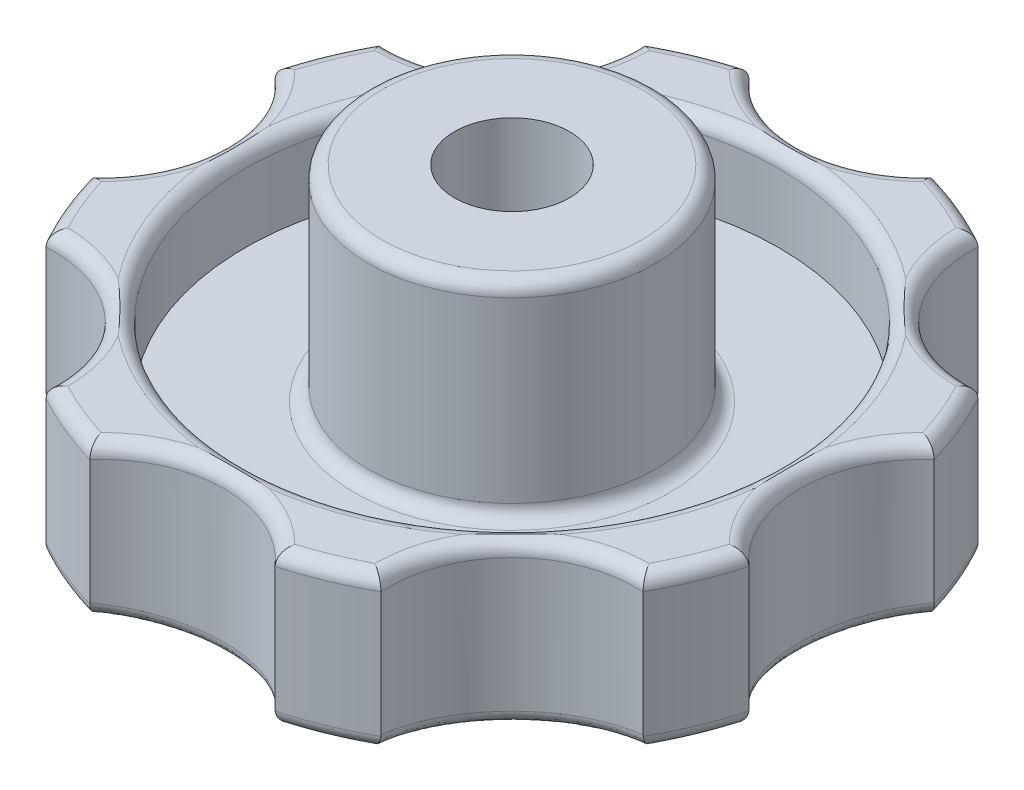
from build123d import *

# Parameters (mm, degrees)
SKETCH2_R          = 4.2
CUT_EXTRUDE1_DEPTH = 42.641325747
SKETCH3_R          = 9
CUT_EXTRUDE2_DEPTH = 38.650100644
FILLET1_R          = 1
FILLET2_R          = 1


with BuildPart() as part:
    # Sketch1 → Revolve4 (revolve)
    with BuildSketch(Plane.XY, mode=Mode.PRIVATE) as revolve4_sk:
        with BuildLine():
            Line((0, 0), (0, 22))
            Line((0, 22), (-10.5, 22))
            Line((-10.5, 22), (-10.5, 7))
            Line((-10.5, 7), (-19.5, 7))
            Line((-19.5, 7), (-19.5, 13))
            Line((-19.5, 13), (-25, 13))
            Line((-25, 13), (-25, 2))
            add(Edge.make_bspline(
                [(-0.007465499, 1.993e-06), (-12.589679051, 0.003656939), (-25, 2)],
                knots=[0.00029658, 0.00029658, 0.00029658, 1, 1, 1], degree=2))
            Line((-0.007465499, 1.993e-06), (0, 0))
        make_face()
    revolve(revolve4_sk.sketch.rotate(Axis((0, 66.230366492, 0), (0, -1, 0)), 270), axis=Axis((0, 66.230366492, 0), (0, -1, 0)))

    # Sketch2 → Cut-Extrude1 (cut, through all)
    with BuildSketch(Plane(origin=(0, 22, 0), x_dir=(1, 0, 0), z_dir=(0, 1, 0))):
        with Locations(Location((0, 0, 0), (0, 0, 270))):
            Circle(SKETCH2_R)
    extrude(amount=-CUT_EXTRUDE1_DEPTH, mode=Mode.SUBTRACT)

    # Sketch3 → Cut-Extrude2 (cut, through all)
    with BuildSketch(Plane(origin=(0, 13, 0), x_dir=(1, 0, 0), z_dir=(0, 1, 0))):
        with Locations((0, 30)):
            Circle(SKETCH3_R)
        with Locations((21.213203436, 21.213203436)):
            Circle(SKETCH3_R)
        with Locations((30, 0)):
            Circle(SKETCH3_R)
        with Locations((21.213203436, -21.213203436)):
            Circle(SKETCH3_R)
        with Locations((0, -30)):
            Circle(SKETCH3_R)
        with Locations((-21.213203436, -21.213203436)):
            Circle(SKETCH3_R)
        with Locations((-30, 0)):
            Circle(SKETCH3_R)
        with Locations((-21.213203436, 21.213203436)):
            Circle(SKETCH3_R)
    extrude(amount=-CUT_EXTRUDE2_DEPTH, mode=Mode.SUBTRACT)

    # Fillet1
    fillet1_edges = [part.edges().sort_by_distance(p)[0] for p in [
        (9.567085809, 2, 23.096988313),
        (1e-09, 0.056659399, -4.2),
        (23.096988313, 2, 9.567085809),
        (23.096988313, 2, -9.567085809),
        (9.567085809, 2, -23.096988313),
        (-9.567085809, 2, -23.096988313),
        (-23.096988313, 2, -9.567085809),
        (-23.096988313, 2, 9.567085809),
        (-9.567085809, 2, 23.096988313),
        (2e-09, 1.408907997, -21),
        (14.849242406, 1.408907997, -14.849242404),
        (21, 1.408907997, 2e-09),
        (14.849242404, 1.408907997, 14.849242406),
        (3.724530255, 1.564248432, 21.806839769),
        (-14.849242407, 1.408907997, 14.849242403),
        (-21, 1.408907997, 0),
        (-14.849242406, 1.408907998, -14.849242405),
    ]]
    fillet(fillet1_edges, radius=FILLET1_R)

    # Fillet2
    # the kernel refuses this fillet: 1 mm, written as the material it adds along each edge
    with BuildSketch(Plane(origin=(0, 7, 0), x_dir=(0, 0, 1), z_dir=(1, 0, 0))) as fillet2_piece_1:
        with BuildLine():
            CenterArc((10.5 + FILLET2_R, -FILLET2_R), FILLET2_R, 90, 90)
            Line((10.5 + FILLET2_R, 0), (10.5, 0))
            Line((10.5, 0), (10.5, -FILLET2_R))
        make_face()
    revolve(axis=Axis((0, 7, 0), (0, -1, 0)))
    # the kernel refuses this fillet: 1 mm, written as the material it takes off along each edge
    with BuildSketch(Plane(origin=(0, 13, 0), x_dir=(0.5739240996560954, 0, 0.8189084978396185), z_dir=(0.8189084978396185, 0, -0.5739240996560954))) as fillet2_2_piece_1:
        with BuildLine():
            CenterArc((25 - FILLET2_R, FILLET2_R), FILLET2_R, 270, 90)
            Line((25 - FILLET2_R, 0), (25, 0))
            Line((25, 0), (25, FILLET2_R))
        make_face()
    revolve(axis=Axis((0, 13, 0), (0, -1, 0)), revolution_arc=25.048642011, mode=Mode.SUBTRACT)
    with BuildSketch(Plane(origin=(0, 13, 0), x_dir=(0, 0, 1), z_dir=(1, 0, 0))) as fillet2_2_piece_2:
        with BuildLine():
            CenterArc((19.5 + FILLET2_R, FILLET2_R), FILLET2_R, 180, 90)
            Line((19.5, FILLET2_R), (19.5, 0))
            Line((19.5, 0), (19.5 + FILLET2_R, 0))
        make_face()
    revolve(axis=Axis((0, 13, 0), (0, -1, 0)), mode=Mode.SUBTRACT)
    with BuildSketch(Plane(origin=(0, 22, 0), x_dir=(0, 0, 1), z_dir=(1, 0, 0))) as fillet2_2_piece_3:
        with BuildLine():
            CenterArc((10.5 - FILLET2_R, FILLET2_R), FILLET2_R, 270, 90)
            Line((10.5, FILLET2_R), (10.5, 0))
            Line((10.5, 0), (10.5 - FILLET2_R, 0))
        make_face()
    revolve(axis=Axis((0, 22, 0), (0, -1, 0)), mode=Mode.SUBTRACT)
    with BuildSketch(Plane(origin=(0, 13, 0), x_dir=(0.9848813747468986, 0, 0.1732301292404387), z_dir=(0.1732301292404387, 0, -0.9848813747468986))) as fillet2_2_piece_4:
        with BuildLine():
            CenterArc((25 - FILLET2_R, FILLET2_R), FILLET2_R, 270, 90)
            Line((25 - FILLET2_R, 0), (25, 0))
            Line((25, 0), (25, FILLET2_R))
        make_face()
    revolve(axis=Axis((0, 13, 0), (0, -1, 0)), revolution_arc=25.048642011, mode=Mode.SUBTRACT)
    with BuildSketch(Plane(origin=(0, 13, 0), x_dir=(0.8189084978396073, 0, -0.5739240996561114), z_dir=(-0.5739240996561114, 0, -0.8189084978396073))) as fillet2_2_piece_5:
        with BuildLine():
            CenterArc((25 - FILLET2_R, FILLET2_R), FILLET2_R, 270, 90)
            Line((25 - FILLET2_R, 0), (25, 0))
            Line((25, 0), (25, FILLET2_R))
        make_face()
    revolve(axis=Axis((0, 13, 0), (0, -1, 0)), revolution_arc=25.048642011, mode=Mode.SUBTRACT)
    with BuildSketch(Plane(origin=(0, 13, 0), x_dir=(0.1732301292405236, 0, -0.9848813747468838), z_dir=(-0.9848813747468838, 0, -0.1732301292405236))) as fillet2_2_piece_6:
        with BuildLine():
            CenterArc((25 - FILLET2_R, FILLET2_R), FILLET2_R, 270, 90)
            Line((25 - FILLET2_R, 0), (25, 0))
            Line((25, 0), (25, FILLET2_R))
        make_face()
    revolve(axis=Axis((0, 13, 0), (0, -1, 0)), revolution_arc=25.048642011, mode=Mode.SUBTRACT)
    with BuildSketch(Plane(origin=(0, 13, 0), x_dir=(-0.5739240996560401, 0, -0.8189084978396572), z_dir=(-0.8189084978396572, 0, 0.5739240996560401))) as fillet2_2_piece_7:
        with BuildLine():
            CenterArc((25 - FILLET2_R, FILLET2_R), FILLET2_R, 270, 90)
            Line((25 - FILLET2_R, 0), (25, 0))
            Line((25, 0), (25, FILLET2_R))
        make_face()
    revolve(axis=Axis((0, 13, 0), (0, -1, 0)), revolution_arc=25.048642011, mode=Mode.SUBTRACT)
    with BuildSketch(Plane(origin=(0, 13, 0), x_dir=(-0.9848813747468774, 0, -0.1732301292405593), z_dir=(-0.1732301292405593, 0, 0.9848813747468774))) as fillet2_2_piece_8:
        with BuildLine():
            CenterArc((25 - FILLET2_R, FILLET2_R), FILLET2_R, 270, 90)
            Line((25 - FILLET2_R, 0), (25, 0))
            Line((25, 0), (25, FILLET2_R))
        make_face()
    revolve(axis=Axis((0, 13, 0), (0, -1, 0)), revolution_arc=25.048642011, mode=Mode.SUBTRACT)
    with BuildSketch(Plane(origin=(0, 13, 0), x_dir=(-0.8189084978396822, 0, 0.5739240996560044), z_dir=(0.5739240996560044, 0, 0.8189084978396822))) as fillet2_2_piece_9:
        with BuildLine():
            CenterArc((25 - FILLET2_R, FILLET2_R), FILLET2_R, 270, 90)
            Line((25 - FILLET2_R, 0), (25, 0))
            Line((25, 0), (25, FILLET2_R))
        make_face()
    revolve(axis=Axis((0, 13, 0), (0, -1, 0)), revolution_arc=25.048642011, mode=Mode.SUBTRACT)
    with BuildSketch(Plane(origin=(0, 13, 0), x_dir=(-0.17323012924051334, 0, 0.9848813747468855), z_dir=(0.9848813747468855, 0, 0.17323012924051334))) as fillet2_2_piece_10:
        with BuildLine():
            CenterArc((25 - FILLET2_R, FILLET2_R), FILLET2_R, 270, 90)
            Line((25 - FILLET2_R, 0), (25, 0))
            Line((25, 0), (25, FILLET2_R))
        make_face()
    revolve(axis=Axis((0, 13, 0), (0, -1, 0)), revolution_arc=25.048642011, mode=Mode.SUBTRACT)
    with BuildSketch(Plane(origin=(-21.213203436, 13, -21.213203436), x_dir=(-0.3367599620660339, 0, 0.9415905309365018), z_dir=(-0.9415905309365018, 0, -0.3367599620660339))) as fillet2_2_piece_11:
        with BuildLine():
            CenterArc((9 + FILLET2_R, -FILLET2_R), FILLET2_R, 90, 90)
            Line((9 + FILLET2_R, 0), (9, 0))
            Line((9, 0), (9, -FILLET2_R))
        make_face()
    revolve(axis=Axis((-21.213203436, 13, -21.213203436), (0, 1, 0)), revolution_arc=129.359191837, mode=Mode.SUBTRACT)
    with BuildSketch(Plane(origin=(-30, 13, 0), x_dir=(0.42767979671725503, 0, 0.903930302335245), z_dir=(-0.903930302335245, 0, 0.42767979671725503))) as fillet2_2_piece_12:
        with BuildLine():
            CenterArc((9 + FILLET2_R, -FILLET2_R), FILLET2_R, 90, 90)
            Line((9 + FILLET2_R, 0), (9, 0))
            Line((9, 0), (9, -FILLET2_R))
        make_face()
    revolve(axis=Axis((-30, 13, 0), (0, 1, 0)), revolution_arc=129.359191837, mode=Mode.SUBTRACT)
    with BuildSketch(Plane(origin=(-21.213203436, 13, 21.213203436), x_dir=(0.9415905309365301, 0, 0.3367599620659549), z_dir=(-0.3367599620659549, 2.836541495786934e-15, 0.9415905309365301))) as fillet2_2_piece_13:
        with BuildLine():
            CenterArc((9 + FILLET2_R, -FILLET2_R), FILLET2_R, 90, 90)
            Line((9 + FILLET2_R, 0), (9, 0))
            Line((9, 0), (9, -FILLET2_R))
        make_face()
    revolve(axis=Axis((-21.213203436, 13, 21.213203436), (0, 1, 0)), revolution_arc=129.359191837, mode=Mode.SUBTRACT)
    with BuildSketch(Plane(origin=(0, 13, 30), x_dir=(0.9039303023351691, 0, -0.42767979671741513), z_dir=(0.42767979671741513, 0, 0.9039303023351691))) as fillet2_2_piece_14:
        with BuildLine():
            CenterArc((9 + FILLET2_R, -FILLET2_R), FILLET2_R, 90, 90)
            Line((9 + FILLET2_R, 0), (9, 0))
            Line((9, 0), (9, -FILLET2_R))
        make_face()
    revolve(axis=Axis((0, 13, 30), (0, 1, 0)), revolution_arc=129.359191837, mode=Mode.SUBTRACT)
    with BuildSketch(Plane(origin=(21.213203436, 13, 21.213203436), x_dir=(0.33675996206574343, 0, -0.9415905309366057), z_dir=(0.9415905309366057, 0, 0.33675996206574343))) as fillet2_2_piece_15:
        with BuildLine():
            CenterArc((9 + FILLET2_R, -FILLET2_R), FILLET2_R, 90, 90)
            Line((9 + FILLET2_R, 0), (9, 0))
            Line((9, 0), (9, -FILLET2_R))
        make_face()
    revolve(axis=Axis((21.213203436, 13, 21.213203436), (0, 1, 0)), revolution_arc=129.359191837, mode=Mode.SUBTRACT)
    with BuildSketch(Plane(origin=(30, 13, 0), x_dir=(-0.4276797967175578, 0, -0.9039303023351017), z_dir=(0.9039303023351017, 0, -0.4276797967175578))) as fillet2_2_piece_16:
        with BuildLine():
            CenterArc((9 + FILLET2_R, -FILLET2_R), FILLET2_R, 90, 90)
            Line((9 + FILLET2_R, 0), (9, 0))
            Line((9, 0), (9, -FILLET2_R))
        make_face()
    revolve(axis=Axis((30, 13, 0), (0, 1, 0)), revolution_arc=129.359191837, mode=Mode.SUBTRACT)
    with BuildSketch(Plane(origin=(21.213203436, 13, -21.213203436), x_dir=(-0.9415905309365996, 0, -0.3367599620657604), z_dir=(0.3367599620657604, 0, -0.9415905309365996))) as fillet2_2_piece_17:
        with BuildLine():
            CenterArc((9 + FILLET2_R, -FILLET2_R), FILLET2_R, 90, 90)
            Line((9 + FILLET2_R, 0), (9, 0))
            Line((9, 0), (9, -FILLET2_R))
        make_face()
    revolve(axis=Axis((21.213203436, 13, -21.213203436), (0, 1, 0)), revolution_arc=129.359191837, mode=Mode.SUBTRACT)
    with BuildSketch(Plane(origin=(0, 13, -30), x_dir=(-0.9039303023352174, 0, 0.42767979671731343), z_dir=(-0.42767979671731343, 0, -0.9039303023352174))) as fillet2_2_piece_18:
        with BuildLine():
            CenterArc((9 + FILLET2_R, -FILLET2_R), FILLET2_R, 90, 90)
            Line((9 + FILLET2_R, 0), (9, 0))
            Line((9, 0), (9, -FILLET2_R))
        make_face()
    revolve(axis=Axis((0, 13, -30), (0, 1, 0)), revolution_arc=129.359191837, mode=Mode.SUBTRACT)


solid = part.part
